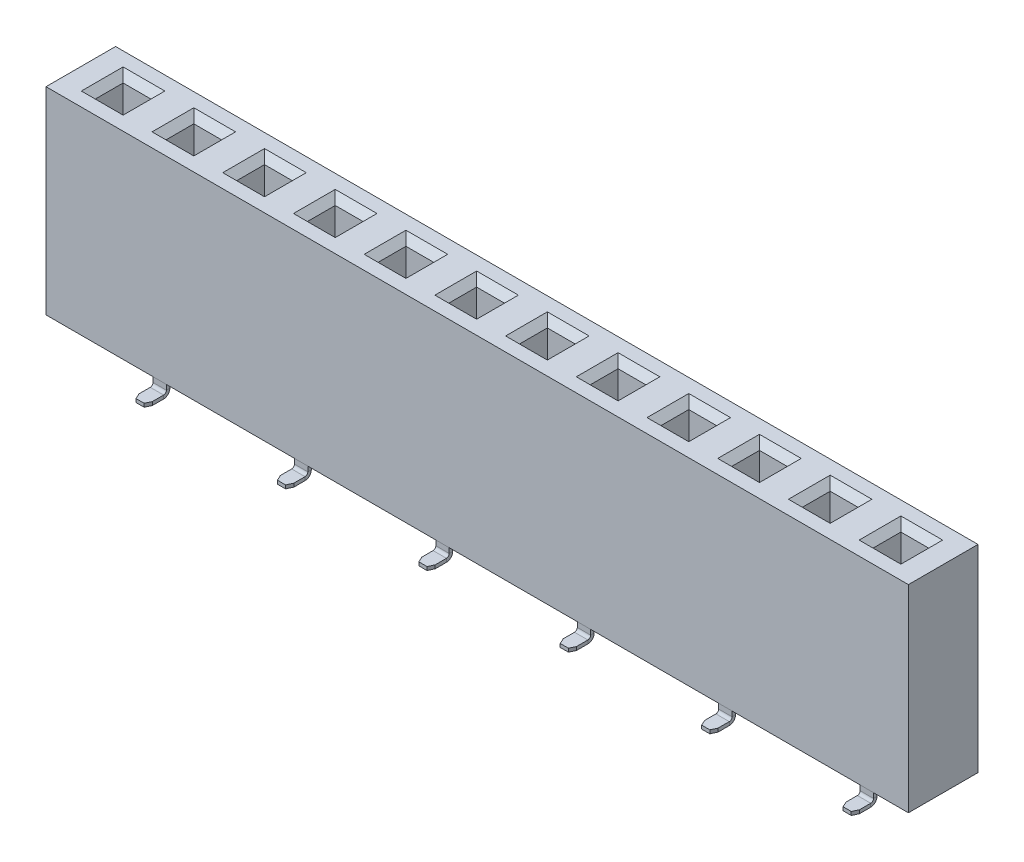
from build123d import *
from OCP.BRepFilletAPI import BRepFilletAPI_MakeChamfer

# Parameters (mm, degrees)
SKETCH1_W                  = 30.98
SKETCH1_H                  = 7.1
BOSS_EXTRUDE1_DEPTH        = 2.5
SKETCH2_W                  = 1
SKETCH2_H                  = 1
CUT_EXTRUDE1_DEPTH         = 2.5
CHAMFER1_SIZE              = 0.25
LPATTERN6_COUNT            = 12
LPATTERN6_PITCH            = 2.54
CHAMFER1_OF_LPATTERN6_SIZE = 0.25
BASE_FLANGE2_DEPTH         = 0.24
BASE_FLANGE2_DEPTH_BACK    = 0.24
BASE_FLANGE3_DEPTH         = 0.24
BASE_FLANGE3_DEPTH_BACK    = 0.24
CHAMFER3_SIZE              = 0.2
CHAMFER3_SIZE2             = 0.093261532
CHAMFER4_SIZE              = 0.2
CHAMFER4_SIZE2             = 0.093261532
LPATTERN4_COUNT            = 6
LPATTERN4_PITCH            = 5.08
LPATTERN3_COUNT            = 6
LPATTERN3_PITCH            = 5.08


# Sheet-metal steps are written as plain solids
with BuildPart() as part:
    # Sketch1 → Boss-Extrude1 (new body)
    with BuildSketch(Plane.XY):
        Rectangle(SKETCH1_W, SKETCH1_H)
    extrude(amount=BOSS_EXTRUDE1_DEPTH)

    # Sketch2 → Cut-Extrude1 (cut)
    with BuildSketch(Plane(origin=(0, 3.55, 0), x_dir=(1, 0, 0), z_dir=(0, 1, 0))):
        with Locations((-13.97, -1.25)):
            Rectangle(SKETCH2_W, SKETCH2_H)
    cut_extrude1 = extrude(amount=-CUT_EXTRUDE1_DEPTH, mode=Mode.SUBTRACT)

    # Chamfer1
    chamfer1_edges = [part.edges().sort_by_distance(p)[0] for p in [
        (-13.47, 3.55, 1.25),
        (-13.97, 3.55, 0.75),
        (-14.47, 3.55, 1.25),
        (-13.97, 3.55, 1.75),
    ]]
    chamfer(chamfer1_edges, length=CHAMFER1_SIZE)

    # LPattern6: Cut-Extrude1 ×12
    with Locations(*[(i * LPATTERN6_PITCH, 0, 0) for i in range(1, LPATTERN6_COUNT)]):
        add(cut_extrude1, mode=Mode.SUBTRACT)

    # Chamfer1 of LPattern6
    chamfer1_of_lpattern6_edges = [part.edges().sort_by_distance(p)[0] for p in [
        (-10.93, 3.55, 1.25),
        (-11.43, 3.55, 0.75),
        (-11.93, 3.55, 1.25),
        (-11.43, 3.55, 1.75),
        (-8.39, 3.55, 1.25),
        (-8.89, 3.55, 0.75),
        (-9.39, 3.55, 1.25),
        (-8.89, 3.55, 1.75),
        (-5.85, 3.55, 1.25),
        (-6.35, 3.55, 0.75),
        (-6.85, 3.55, 1.25),
        (-6.35, 3.55, 1.75),
        (-3.31, 3.55, 1.25),
        (-3.81, 3.55, 0.75),
        (-4.31, 3.55, 1.25),
        (-3.81, 3.55, 1.75),
        (-0.77, 3.55, 1.25),
        (-1.27, 3.55, 0.75),
        (-1.77, 3.55, 1.25),
        (-1.27, 3.55, 1.75),
        (1.77, 3.55, 1.25),
        (1.27, 3.55, 0.75),
        (0.77, 3.55, 1.25),
        (1.27, 3.55, 1.75),
        (4.31, 3.55, 1.25),
        (3.81, 3.55, 0.75),
        (3.31, 3.55, 1.25),
        (3.81, 3.55, 1.75),
        (6.85, 3.55, 1.25),
        (6.35, 3.55, 0.75),
        (5.85, 3.55, 1.25),
        (6.35, 3.55, 1.75),
        (9.39, 3.55, 1.25),
        (8.89, 3.55, 0.75),
        (8.39, 3.55, 1.25),
        (8.89, 3.55, 1.75),
        (11.93, 3.55, 1.25),
        (11.43, 3.55, 0.75),
        (10.93, 3.55, 1.25),
        (11.43, 3.55, 1.75),
        (14.47, 3.55, 1.25),
        (13.97, 3.55, 0.75),
        (13.47, 3.55, 1.25),
        (13.97, 3.55, 1.75),
    ]]
    chamfer(chamfer1_of_lpattern6_edges, length=CHAMFER1_OF_LPATTERN6_SIZE)


with BuildPart() as body_2:
    # Sketch5 → Base-Flange2 (new, two sides: drawn at the far end of the back side and taken through both)
    with BuildSketch(Plane.ZY.offset(13.97).offset(-BASE_FLANGE2_DEPTH_BACK)):
        with BuildLine():
            Line((0.15, -3.55), (0.15, -3.755))
            ThreePointArc((0.15, -3.755), (0.084099026, -3.914099026), (-0.075, -3.98))
            Line((-0.075, -3.98), (-0.68, -3.98))
            Line((-0.68, -3.98), (-0.68, -3.855))
            Line((-0.68, -3.855), (-0.075, -3.855))
            ThreePointArc((-0.075, -3.855), (-0.004289322, -3.825710678), (0.025, -3.755))
            Line((0.025, -3.755), (0.025, -3.55))
            Line((0.025, -3.55), (0.15, -3.55))
        make_face()
    extrude(amount=BASE_FLANGE2_DEPTH + BASE_FLANGE2_DEPTH_BACK)

    # Chamfer4: one chamfer whose edges measure the first distance from different faces: ONE call of the kernel's chamfer builder (chamfer() names one face for all edges)
    chamfer4_edges_1 = [body_2.edges().sort_by_distance(p)[0] for p in [
        (-13.73, -3.9175, -0.68),
    ]]
    chamfer4_side_1 = [body_2.faces().sort_by_distance(p)[0] for p in [
        (-13.73, -3.6525, 0.034347727),
    ]]
    chamfer4_edges_2 = [body_2.edges().sort_by_distance(p)[0] for p in [
        (-14.21, -3.9175, -0.68),
    ]]
    chamfer4_side_2 = [body_2.faces().sort_by_distance(p)[0] for p in [
        (-14.21, -3.6525, 0.034347727),
    ]]
    chamfer4 = BRepFilletAPI_MakeChamfer(body_2.part.solid().wrapped)
    for e in chamfer4_edges_1:
        chamfer4.Add(CHAMFER4_SIZE, CHAMFER4_SIZE2, e.wrapped, chamfer4_side_1[0].wrapped)  # the first distance lies on this face
    for e in chamfer4_edges_2:
        chamfer4.Add(CHAMFER4_SIZE, CHAMFER4_SIZE2, e.wrapped, chamfer4_side_2[0].wrapped)  # the first distance lies on this face
    add(Compound.cast(chamfer4.Shape()), mode=Mode.REPLACE)


with BuildPart() as body_3:
    # Sketch22 → Base-Flange3 (new, two sides: drawn at the far end of the back side and taken through both)
    with BuildSketch(Plane.ZY.offset(11.43).offset(-BASE_FLANGE3_DEPTH_BACK)):
        with BuildLine():
            Line((2.35, -3.55), (2.35, -3.755))
            ThreePointArc((2.35, -3.755), (2.415900974, -3.914099026), (2.575, -3.98))
            Line((2.575, -3.98), (3.18, -3.98))
            Line((3.18, -3.98), (3.18, -3.855))
            Line((3.18, -3.855), (2.575, -3.855))
            ThreePointArc((2.575, -3.855), (2.504289322, -3.825710678), (2.475, -3.755))
            Line((2.475, -3.755), (2.475, -3.55))
            Line((2.475, -3.55), (2.35, -3.55))
        make_face()
    extrude(amount=BASE_FLANGE3_DEPTH + BASE_FLANGE3_DEPTH_BACK)

    # Chamfer3: one chamfer whose edges measure the first distance from different faces: ONE call of the kernel's chamfer builder (chamfer() names one face for all edges)
    chamfer3_edges_1 = [body_3.edges().sort_by_distance(p)[0] for p in [
        (-11.19, -3.9175, 3.18),
    ]]
    chamfer3_side_1 = [body_3.faces().sort_by_distance(p)[0] for p in [
        (-11.19, -3.6525, 2.465652273),
    ]]
    chamfer3_edges_2 = [body_3.edges().sort_by_distance(p)[0] for p in [
        (-11.67, -3.9175, 3.18),
    ]]
    chamfer3_side_2 = [body_3.faces().sort_by_distance(p)[0] for p in [
        (-11.67, -3.6525, 2.465652273),
    ]]
    chamfer3 = BRepFilletAPI_MakeChamfer(body_3.part.solid().wrapped)
    for e in chamfer3_edges_1:
        chamfer3.Add(CHAMFER3_SIZE, CHAMFER3_SIZE2, e.wrapped, chamfer3_side_1[0].wrapped)  # the first distance lies on this face
    for e in chamfer3_edges_2:
        chamfer3.Add(CHAMFER3_SIZE, CHAMFER3_SIZE2, e.wrapped, chamfer3_side_2[0].wrapped)  # the first distance lies on this face
    add(Compound.cast(chamfer3.Shape()), mode=Mode.REPLACE)


with BuildPart() as lpattern4_1:
    # LPattern4: pattern copy
    add(body_2.part.moved(Location(Vector(1, 0, 0) * (1 * LPATTERN4_PITCH))))


with BuildPart() as lpattern4_2:
    # LPattern4: pattern copy
    add(body_2.part.moved(Location(Vector(1, 0, 0) * (2 * LPATTERN4_PITCH))))


with BuildPart() as lpattern4_3:
    # LPattern4: pattern copy
    add(body_2.part.moved(Location(Vector(1, 0, 0) * (3 * LPATTERN4_PITCH))))


with BuildPart() as lpattern4_4:
    # LPattern4: pattern copy
    add(body_2.part.moved(Location(Vector(1, 0, 0) * (4 * LPATTERN4_PITCH))))


with BuildPart() as lpattern4_5:
    # LPattern4: pattern copy
    add(body_2.part.moved(Location(Vector(1, 0, 0) * (5 * LPATTERN4_PITCH))))


with BuildPart() as lpattern3_1:
    # LPattern3: pattern copy
    add(body_3.part.moved(Location(Vector(1, 0, 0) * (1 * LPATTERN3_PITCH))))


with BuildPart() as lpattern3_2:
    # LPattern3: pattern copy
    add(body_3.part.moved(Location(Vector(1, 0, 0) * (2 * LPATTERN3_PITCH))))


with BuildPart() as lpattern3_3:
    # LPattern3: pattern copy
    add(body_3.part.moved(Location(Vector(1, 0, 0) * (3 * LPATTERN3_PITCH))))


with BuildPart() as lpattern3_4:
    # LPattern3: pattern copy
    add(body_3.part.moved(Location(Vector(1, 0, 0) * (4 * LPATTERN3_PITCH))))


with BuildPart() as lpattern3_5:
    # LPattern3: pattern copy
    add(body_3.part.moved(Location(Vector(1, 0, 0) * (5 * LPATTERN3_PITCH))))


solid = Compound([part.part, body_2.part, body_3.part, lpattern4_1.part, lpattern4_2.part, lpattern4_3.part, lpattern4_4.part, lpattern4_5.part, lpattern3_1.part, lpattern3_2.part, lpattern3_3.part, lpattern3_4.part, lpattern3_5.part])
